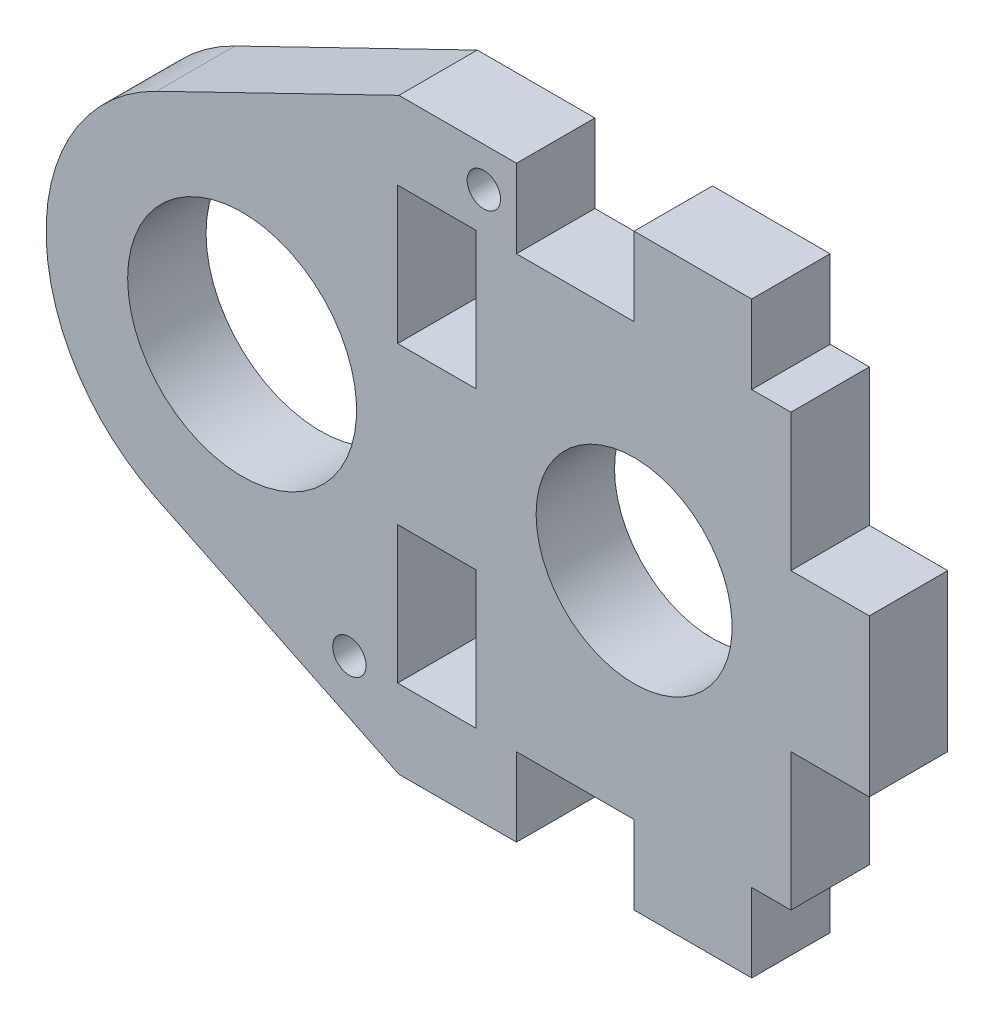
from build123d import *

# Parameters (mm, degrees)
MASS_DEPTH                = 6.35
SKETCH4_R                 = 9.271
CUT_EXTRUDE1_DEPTH        = 54.623672769
SKETCH3_W                 = 9.525
SKETCH3_H                 = 12.7
CUT_EXTRUDE2_DEPTH        = 54.623672769
LPATTERN1_COUNT           = 2
LPATTERN1_PITCH           = 19.05
CAVITY1_START             = -19.1516
CAVITY1_OUTLINE_W         = 11.1125
CAVITY1_OUTLINE_H         = 6.35
CAVITY1_DEPTH             = 6.35
CAVITY1_START_2           = 12.7
CAVITY1_2_OUTLINE_W       = 11.1125
CAVITY1_2_OUTLINE_H       = 6.35
CAVITY1_2_DEPTH           = 6.35
SKETCH5_R                 = 7.9375
CUT_EXTRUDE3_DEPTH        = 54.623672769
F_6_32_TAPPED_HOLE1_D     = 2.7051
F_6_32_TAPPED_HOLE1_DEPTH = 152.4
F_6_32_TAPPED_HOLE1_TIP   = 0.81269403


# Read off the part's stored shape, not the designer's step: Cavity1
with BuildPart() as part:
    # Sketch1 → Mass (new body)
    with BuildSketch(Plane.XY):
        with BuildLine():
            Line((-19.05, -23.8125), (19.05, -23.8125))
            Line((19.05, -23.8125), (19.05, 23.8125))
            Line((19.05, 23.8125), (-19.05, 23.8125))
            Line((-19.05, 23.8125), (-38.68314018, 14.281008096))
            ThreePointArc((-38.68314018, 14.281008096), (-47.625, 0), (-38.68314018, -14.281008096))
            Line((-38.68314018, -14.281008096), (-19.05, -23.8125))
        make_face()
    extrude(amount=MASS_DEPTH)

    # Sketch4 → Cut-Extrude1 (cut, through all)
    with BuildSketch(Plane(origin=(0, 0, 0), x_dir=(-1, 0, 0), z_dir=(0, 0, -1))):
        with Locations((31.75, 0)):
            Circle(SKETCH4_R)
    extrude(amount=-CUT_EXTRUDE1_DEPTH, mode=Mode.SUBTRACT)

    # Sketch3 → Cut-Extrude2 (cut, through all)
    with BuildSketch(Plane(origin=(0, 0, 0), x_dir=(-1, 0, 0), z_dir=(0, 0, -1))):
        with Locations((-14.2875, 23.8125)):
            Rectangle(SKETCH3_W, SKETCH3_H)
        with Locations((-14.2875, -23.8125)):
            Rectangle(SKETCH3_W, SKETCH3_H)
    cut_extrude2 = extrude(amount=-CUT_EXTRUDE2_DEPTH, mode=Mode.SUBTRACT)

    # LPattern1: Cut-Extrude2 ×2
    with Locations(*[(-i * LPATTERN1_PITCH, 0, 0) for i in range(1, LPATTERN1_COUNT)]):
        add(cut_extrude2, mode=Mode.SUBTRACT)

    # Cavity1 outline → Cavity1 (cut)
    with BuildSketch(Plane.YZ.offset(CAVITY1_START)):
        with Locations((-11.90625, 3.175)):
            Rectangle(CAVITY1_OUTLINE_W, CAVITY1_OUTLINE_H)
        with Locations((11.90625, 3.175)):
            Rectangle(CAVITY1_OUTLINE_W, CAVITY1_OUTLINE_H)
    extrude(amount=CAVITY1_DEPTH, mode=Mode.SUBTRACT)

    # Cavity1 2 outline → Cavity1 2 (cut)
    with BuildSketch(Plane.YZ.offset(CAVITY1_START_2)):
        with Locations((-11.90625, 3.175)):
            Rectangle(CAVITY1_2_OUTLINE_W, CAVITY1_2_OUTLINE_H)
        with Locations((11.90625, 3.175)):
            Rectangle(CAVITY1_2_OUTLINE_W, CAVITY1_2_OUTLINE_H)
    extrude(amount=CAVITY1_2_DEPTH, mode=Mode.SUBTRACT)

    # Sketch5 → Cut-Extrude3 (cut, through all)
    with BuildSketch(Plane(origin=(0, 0, 0), x_dir=(-1, 0, 0), z_dir=(0, 0, -1))):
        Circle(SKETCH5_R)
    extrude(amount=-CUT_EXTRUDE3_DEPTH, mode=Mode.SUBTRACT)

    # #6-32 Tapped Hole1
    with Locations(Plane(origin=(0, 0, 0), x_dir=(-1, 0, 0), z_dir=(0, 0, -1))):
        with Locations((23.059852363, -17.521321241), (12.169849394, 20.6375)):
            Hole(F_6_32_TAPPED_HOLE1_D / 2, depth=F_6_32_TAPPED_HOLE1_DEPTH)
            with Locations((0, 0, -(F_6_32_TAPPED_HOLE1_DEPTH + F_6_32_TAPPED_HOLE1_TIP / 2))):  # 118° drill point
                Cone(0, F_6_32_TAPPED_HOLE1_D / 2, F_6_32_TAPPED_HOLE1_TIP, mode=Mode.SUBTRACT)


solid = part.part
